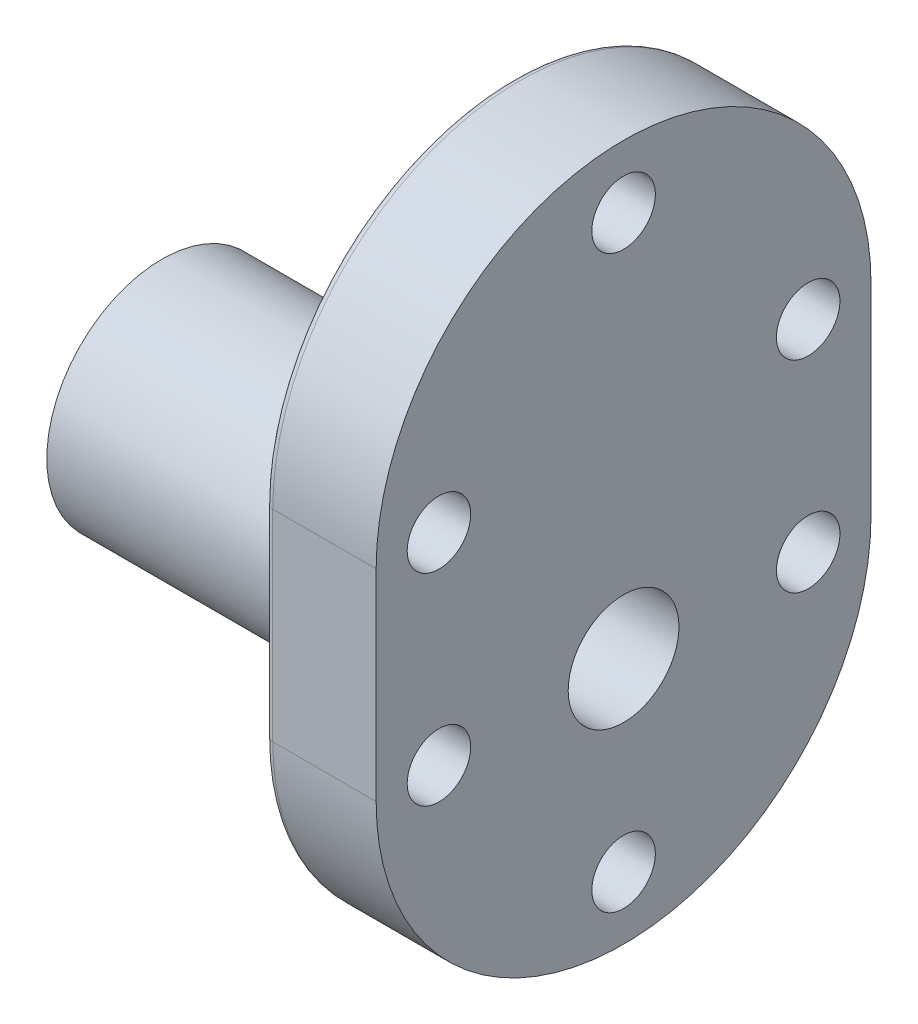
from build123d import *

# Parameters (mm, degrees)
BOSS_EXTRUDE1_DEPTH              = 38.1
SKETCH2_R                        = 39.62
BOSS_EXTRUDE2_DEPTH              = 120.65
F_1_16_1_25_DIAMETER_HOLE1_D     = 31.75
F_1_16_1_25_DIAMETER_HOLE1_DEPTH = 71.94630657
F_1_16_1_25_DIAMETER_HOLE1_TIP   = 4.25369343
SKETCH4_R                        = 19.05
CUT_EXTRUDE1_DEPTH               = 238.24024216
FILLET1_R                        = 3.81
SKETCH6_R                        = 10.922
CUT_EXTRUDE2_DEPTH               = 214.630036512
FILLET2_R                        = 2.54
F_1_16_2_5_DIAMETER_HOLE1_D      = 63.5
F_1_16_2_5_DIAMETER_HOLE1_DEPTH  = 67.69261314
F_1_16_2_5_DIAMETER_HOLE1_TIP    = 8.50738686


with BuildPart() as part:
    # Sketch1 → Boss-Extrude1 (new body)
    with BuildSketch(Plane(origin=(0, 0, 0), x_dir=(0, 0, -1), z_dir=(1, 0, 0))):
        with BuildLine():
            Line((-85.1, 69.3), (-85.1, 0))
            ThreePointArc((-85.1, 0), (0, -85.1), (85.1, 0))
            Line((85.1, 0), (85.1, 69.3))
            ThreePointArc((85.1, 69.3), (0, 154.4), (-85.1, 69.3))
        make_face()
    extrude(amount=-BOSS_EXTRUDE1_DEPTH)

    # Sketch2 → Boss-Extrude2 (add)
    with BuildSketch(Plane.ZY.offset(38.1)):
        Circle(SKETCH2_R)
    extrude(amount=BOSS_EXTRUDE2_DEPTH)

    # 1/16 (1.25) Diameter Hole1
    with Locations(Plane(origin=(-158.75, 0, 0), x_dir=(0, 0, -1), z_dir=(-1, 0, 0))):
        with Locations((0, 0)):
            Hole(F_1_16_1_25_DIAMETER_HOLE1_D / 2, depth=F_1_16_1_25_DIAMETER_HOLE1_DEPTH)
            with Locations((0, 0, -(F_1_16_1_25_DIAMETER_HOLE1_DEPTH + F_1_16_1_25_DIAMETER_HOLE1_TIP / 2))):  # 150° drill point
                Cone(0, F_1_16_1_25_DIAMETER_HOLE1_D / 2, F_1_16_1_25_DIAMETER_HOLE1_TIP, mode=Mode.SUBTRACT)

    # Sketch4 → Cut-Extrude1 (cut, through all)
    with BuildSketch(Plane.ZY.offset(158.75)):
        Circle(SKETCH4_R)
    extrude(amount=-CUT_EXTRUDE1_DEPTH, mode=Mode.SUBTRACT)

    # Fillet1
    fillet1_edges = [part.edges().sort_by_distance(p)[0] for p in [
        (-38.1, 0, -39.62),
    ]]
    fillet(fillet1_edges, radius=FILLET1_R)

    # Sketch6 → Cut-Extrude2 (cut, through all)
    with BuildSketch(Plane.ZY.offset(38.1)):
        with Locations((0, 132.821)):
            Circle(SKETCH6_R)
        with Locations((63.5, 69.321)):
            Circle(SKETCH6_R)
        with Locations((-63.5, 69.321)):
            Circle(SKETCH6_R)
        with Locations((63.5, -0.021)):
            Circle(SKETCH6_R)
        with Locations((0, -63.521)):
            Circle(SKETCH6_R)
        with Locations((-63.5, -0.021)):
            Circle(SKETCH6_R)
    extrude(amount=-CUT_EXTRUDE2_DEPTH, mode=Mode.SUBTRACT)

    # Fillet2
    fillet2_edges = [part.edges().sort_by_distance(p)[0] for p in [
        (-38.1, 34.65, -85.1),
        (-38.1, -85.1, 0),
        (-38.1, 34.65, 85.1),
        (-38.1, 154.4, 0),
    ]]
    fillet(fillet2_edges, radius=FILLET2_R)

    # 1/16 (2.5) Diameter Hole1
    with Locations(Plane(origin=(-158.75, 0, 0), x_dir=(0, 0, -1), z_dir=(-1, 0, 0))):
        with Locations((0, 0)):
            Hole(F_1_16_2_5_DIAMETER_HOLE1_D / 2, depth=F_1_16_2_5_DIAMETER_HOLE1_DEPTH)
            with Locations((0, 0, -(F_1_16_2_5_DIAMETER_HOLE1_DEPTH + F_1_16_2_5_DIAMETER_HOLE1_TIP / 2))):  # 150° drill point
                Cone(0, F_1_16_2_5_DIAMETER_HOLE1_D / 2, F_1_16_2_5_DIAMETER_HOLE1_TIP, mode=Mode.SUBTRACT)


solid = part.part
